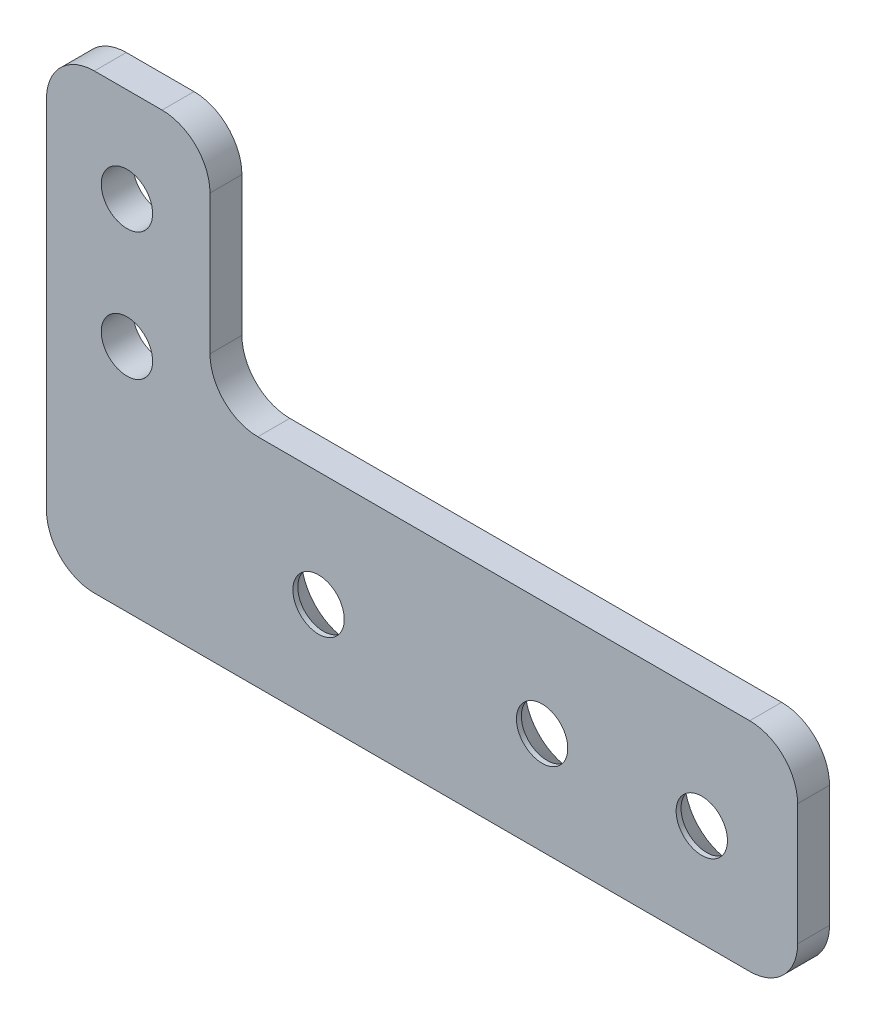
from build123d import *

# Parameters (mm, degrees)
SKETCH1_R                                    = 2.5527
BOSS_EXTRUDE1_DEPTH                          = 3.175
FILLET1_R                                    = 4.7625
CSK_FOR_10_FLAT_HEAD_MACHINE_SCREW3_AT_COUNT = 2
CSK_FOR_10_FLAT_HEAD_MACHINE_SCREW3_AT_PITCH = 15.875
CSK_FOR_10_FLAT_HEAD_MACHINE_SCREW3_2_COUNT  = 2
CSK_FOR_10_FLAT_HEAD_MACHINE_SCREW3_2_PITCH  = 38.1


with BuildPart() as part:
    # Sketch1 → Boss-Extrude1 (new body)
    with BuildSketch(Plane.XY):
        Polygon((-33.401, 23.749), (-33.401, -21.209), (41.275, -21.209), (41.275, 0.381), (-17.145, 0.381), (-17.145, 23.749), align=None)
        with Locations((-25.4, 1.651)):
            Circle(SKETCH1_R, mode=Mode.SUBTRACT)
        with Locations((-25.4, 14.351)):
            Circle(SKETCH1_R, mode=Mode.SUBTRACT)
    extrude(amount=BOSS_EXTRUDE1_DEPTH)

    # Fillet1
    fillet1_edges = [part.edges().sort_by_distance(p)[0] for p in [
        (-33.401, 23.749, 1.5875),
        (-17.145, 23.749, 1.5875),
        (-17.145, 0.381, 1.5875),
        (41.275, 0.381, 1.5875),
        (41.275, -21.209, 1.5875),
        (-33.401, -21.209, 1.5875),
    ]]
    fillet(fillet1_edges, radius=FILLET1_R)

    # Sketch7 → CSK for #10 Flat Head Machine Screw3 (revolve, cut)
    with BuildSketch(Plane(origin=(31.75, -11.049, 0), x_dir=(0, 1, 0), z_dir=(1, 0, 0))):
        Polygon((0, 0), (0, 3.175), (2.5527, 3.175), (2.5527, 2.688180894), (4.8895, 0), align=None)
    csk_for_10_flat_head_machine_screw3 = revolve(axis=Axis((31.75, -11.049, -6.35), (0, 0, 1)), mode=Mode.SUBTRACT)

    # CSK for #10 Flat Head Machine Screw3 at: CSK for #10 Flat Head Machine Screw3 ×2
    with Locations(*[(-i * CSK_FOR_10_FLAT_HEAD_MACHINE_SCREW3_AT_PITCH, 0, 0) for i in range(1, CSK_FOR_10_FLAT_HEAD_MACHINE_SCREW3_AT_COUNT)]):
        add(csk_for_10_flat_head_machine_screw3, mode=Mode.SUBTRACT)

    # CSK for _10 Flat Head Machine Screw3 2: CSK for #10 Flat Head Machine Screw3 ×2
    with Locations(*[(-i * CSK_FOR_10_FLAT_HEAD_MACHINE_SCREW3_2_PITCH, 0, 0) for i in range(1, CSK_FOR_10_FLAT_HEAD_MACHINE_SCREW3_2_COUNT)]):
        add(csk_for_10_flat_head_machine_screw3, mode=Mode.SUBTRACT)


solid = part.part
